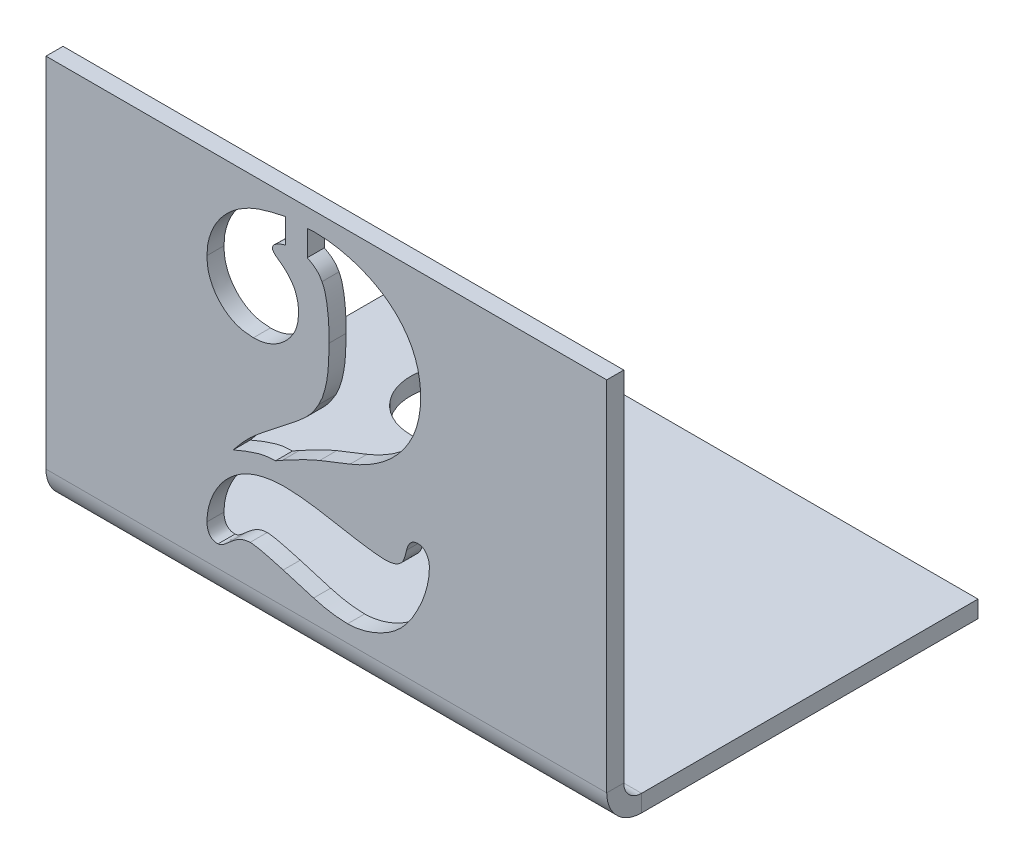
from build123d import *

# Parameters (mm, degrees)
SKETCH1_W            = 50
SKETCH1_H            = 30
BASE_FLANGE1_DEPTH   = 1.51892
EDGE_FLANGE1_DEPTH   = 50
M8_CLEARANCE_HOLE1_D = 9
CUT_EXTRUDE1_DEPTH   = 55.277389816


# Sheet-metal steps are written as plain solids
with BuildPart() as part:
    # Sketch1 → Base-Flange1 (new body)
    with BuildSketch(Plane(origin=(0, 0, 0), x_dir=(1, 0, 0), z_dir=(0, 1, 0))):
        with Locations((0, 15)):
            Rectangle(SKETCH1_W, SKETCH1_H)
    extrude(amount=BASE_FLANGE1_DEPTH)

    # Edge-Flange1 section (across the edge) → Edge-Flange1 (add)
    with BuildSketch(Plane(origin=(-25, 1.51892, 1.5875), x_dir=(0, 0, -1), z_dir=(1, 0, 0))):
        with BuildLine():
            Line((-1.51892, 1.5875), (-1.51892, 33.48108))
            Line((-1.51892, 33.48108), (0, 33.48108))
            Line((0, 33.48108), (0, 1.5875))
            ThreePointArc((0, 1.5875), (0.464967985, 0.464967985), (1.5875, 0))
            Line((1.5875, 0), (1.5875, -1.51892))
            ThreePointArc((1.5875, -1.51892), (-0.609070647, -0.609070647), (-1.51892, 1.5875))
        make_face()
    extrude(amount=EDGE_FLANGE1_DEPTH)

    # M8 Clearance Hole1 (through all)
    with Locations(Plane(origin=(0, 1.51892, 0), x_dir=(1, 0, 0), z_dir=(0, 1, 0))):
        with Locations((-13, 21.89358)):
            Hole(M8_CLEARANCE_HOLE1_D / 2)

    # Sketch11 → Cut-Extrude1 (cut, through all)
    with BuildSketch(Plane.XY.offset(3.10642)):
        with BuildLine():
            Line((-3.647316347, 33.285590278), (-3.647316347, 31.079861111))
            add(Edge.make_bspline(
                [(-3.647316347, 31.079861111), (-3.810339635, 31.035457881), (-4.114208976, 30.952691912), (-4.48274969, 30.752870531), (-4.763416976, 30.532872768), (-4.799006844, 30.340499168), (-4.813983013, 30.259548611)],
                knots=[0, 0, 0, 0, 1.333986203, 2.486500637, 3.363121469, 4, 4, 4, 4], degree=3))
            add(Edge.make_bspline(
                [(-4.813983013, 30.259548611), (-4.800725347, 30.209535104), (-4.770591799, 30.095858654), (-4.644434234, 29.942820848), (-4.470851038, 29.781940796), (-4.327601205, 29.686260997), (-4.248878847, 29.633680556)],
                knots=[0, 0, 0, 0, 0.71099317, 1.616027015, 2.68989741, 4, 4, 4, 4], degree=3))
            add(Edge.make_bspline(
                [(-4.248878847, 29.633680556), (-4.10113349, 29.524765386), (-3.818356416, 29.316307309), (-3.438695332, 28.974348022), (-3.136470959, 28.609228145), (-2.891592844, 28.230492233), (-2.705375929, 27.825549904), (-2.572503605, 27.386368), (-2.491790669, 26.906321015), (-2.484453005, 26.573534551), (-2.48064968, 26.401041667)],
                knots=[0, 0, 0, 0, 1.141533915, 2.18483766, 3.168868271, 4.081072748, 4.983039702, 5.931586172, 6.927881068, 8, 8, 8, 8], degree=3))
            add(Edge.make_bspline(
                [(-2.48064968, 26.401041667), (-2.493833545, 26.144173186), (-2.519898654, 25.63633234), (-2.754251301, 24.904916153), (-3.14419402, 24.235874886), (-3.661805059, 23.637265817), (-4.279520682, 23.134309517), (-4.972324544, 22.771644344), (-5.718765191, 22.538372238), (-6.238168745, 22.512965167), (-6.503219125, 22.5)],
                knots=[0, 0, 0, 0, 0.991379037, 1.960002132, 2.935410263, 3.96848841, 5.004590814, 5.996124549, 6.977427196, 8, 8, 8, 8], degree=3))
            add(Edge.make_bspline(
                [(-6.503219125, 22.5), (-6.788353705, 22.515022429), (-7.341745706, 22.544178107), (-8.136515362, 22.777043998), (-8.853492715, 23.168409838), (-9.482049424, 23.703394986), (-10.000937468, 24.352739178), (-10.373986742, 25.093874041), (-10.611343763, 25.908646232), (-10.635089286, 26.478349438), (-10.647316347, 26.771701389)],
                knots=[0, 0, 0, 0, 1.029099269, 1.997285998, 2.963451024, 3.960585897, 4.960778403, 5.946050082, 6.942378755, 8, 8, 8, 8], degree=3))
            add(Edge.make_bspline(
                [(-10.647316347, 26.771701389), (-10.637207367, 27.054569606), (-10.61710484, 27.617076), (-10.405860119, 28.439323827), (-10.101772493, 29.239337267), (-9.648933313, 29.990108087), (-9.100902708, 30.693428894), (-8.449289557, 31.322858562), (-7.709597457, 31.87812069), (-7.159775465, 32.170595566), (-6.879955236, 32.319444444)],
                knots=[0, 0, 0, 0, 0.958629846, 1.906313207, 2.866915443, 3.856727568, 4.870907364, 5.887603508, 6.924940656, 8, 8, 8, 8], degree=3))
            add(Edge.make_bspline(
                [(-6.879955236, 32.319444444), (-6.674785129, 32.41214962), (-6.23190241, 32.612264154), (-5.48161387, 32.855431525), (-4.608170132, 33.083047436), (-3.980138557, 33.215433135), (-3.647316347, 33.285590278)],
                knots=[0, 0, 0, 0, 0.798279449, 1.723175848, 2.793408359, 4, 4, 4, 4], degree=3))
        make_face()
        with BuildLine():
            Line((-1.702871902, 31.079861111), (-1.702871902, 33.346354167))
            Line((-1.702871902, 33.346354167), (-1.143844125, 33.388888889))
            add(Edge.make_bspline(
                [(-1.143844125, 33.388888889), (-0.788982189, 33.381216325), (-0.084790849, 33.365990818), (0.956855039, 33.228849557), (1.972192209, 33.000858662), (2.955414277, 32.69562596), (3.886975964, 32.308838774), (4.749040093, 31.854614583), (5.529514597, 31.325605134), (5.988092936, 30.913038341), (6.21466282, 30.709201389)],
                knots=[0, 0, 0, 0, 1.062126147, 2.107693046, 3.139094116, 4.174854052, 5.186216919, 6.154744676, 7.088314362, 8, 8, 8, 8], degree=3))
            add(Edge.make_bspline(
                [(6.21466282, 30.709201389), (6.391217286, 30.530779769), (6.739774477, 30.178536407), (7.181128593, 29.588291214), (7.564490126, 28.970373304), (7.873837187, 28.313773948), (8.110846122, 27.622292468), (8.282015002, 26.89795848), (8.386612379, 26.138749999), (8.400955874, 25.619544679), (8.408239209, 25.355902778)],
                knots=[0, 0, 0, 0, 1.011131168, 1.996194421, 2.964178307, 3.939713955, 4.916104062, 5.906671543, 6.937050386, 8, 8, 8, 8], degree=3))
            add(Edge.make_bspline(
                [(8.408239209, 25.355902778), (8.404193481, 25.126781786), (8.396184509, 24.673211059), (8.313601688, 24.00492042), (8.186107121, 23.35695107), (8.010523176, 22.727897526), (7.778642943, 22.117778767), (7.490672166, 21.528036783), (7.157247091, 20.95603062), (6.772545757, 20.407805906), (6.341665427, 19.885749696), (5.863848214, 19.392895499), (5.349947822, 18.923345023), (4.784212938, 18.490663539), (4.178974545, 18.085448248), (3.529159665, 17.707087874), (2.841292037, 17.353553824), (2.357623336, 17.151585865), (2.11310032, 17.049479167)],
                knots=[0, 0, 0, 0, 0.989048548, 1.957932644, 2.903152603, 3.83913997, 4.774882068, 5.717711062, 6.670349052, 7.631303691, 8.60679872, 9.590417157, 10.593637113, 11.61015386, 12.663052221, 13.737209596, 14.856026175, 16, 16, 16, 16], degree=3))
            Line((2.11310032, 17.049479167), (-0.590892736, 15.980034722))
            add(Edge.make_bspline(
                [(-0.590892736, 15.980034722), (-0.808461788, 15.888744669), (-1.289219684, 15.687022901), (-2.056332958, 15.311516557), (-2.946339923, 14.853212915), (-3.576968221, 14.514642154), (-3.914677458, 14.333333333)],
                knots=[0, 0, 0, 0, 0.762815795, 1.685578501, 2.760598724, 4, 4, 4, 4], degree=3))
            Line((-3.914677458, 14.333333333), (-4.534469125, 13.980902778))
            add(Edge.make_bspline(
                [(-4.534469125, 13.980902778), (-4.80262749, 13.970508896), (-5.335924706, 13.949838169), (-6.003944066, 13.804921778), (-6.565122006, 13.617885766), (-7.0763875, 13.448145558), (-7.662479348, 13.202604677), (-8.083027289, 13.028736376), (-8.307906625, 12.935763889)],
                knots=[0, 0, 0, 0, 1.222962542, 2.432154285, 3.101583781, 3.922999798, 4.889366993, 6, 6, 6, 6], degree=3))
            add(Edge.make_bspline(
                [(-8.307906625, 12.935763889), (-8.05969249, 13.245858512), (-7.58402807, 13.840107422), (-6.918656643, 14.526833924), (-6.33261269, 15.053107702), (-5.800924675, 15.49298605), (-5.184544696, 16.000268361), (-4.732216346, 16.3442061), (-4.491934402, 16.526909722)],
                knots=[0, 0, 0, 0, 1.359201953, 2.604702623, 3.26748845, 4.054955857, 4.966770519, 6, 6, 6, 6], degree=3))
            add(Edge.make_bspline(
                [(-4.491934402, 16.526909722), (-4.333947943, 16.648434791), (-4.031775986, 16.880869064), (-3.598228488, 17.214405846), (-3.208730936, 17.526140495), (-2.85829535, 17.809690562), (-2.546267621, 18.066804635), (-2.272622272, 18.295200165), (-2.043312176, 18.501753875), (-1.669646346, 18.847754129), (-1.180263403, 19.402829415), (-0.849575547, 19.962243014), (-0.682038569, 20.245659722)],
                knots=[0, 0, 0, 0, 1.113906191, 2.130506731, 3.056827448, 3.901845037, 4.649693062, 5.316382197, 5.893557715, 6.3740635, 8.162985332, 10, 10, 10, 10], degree=3))
            add(Edge.make_bspline(
                [(-0.682038569, 20.245659722), (-0.604416645, 20.400400772), (-0.445119906, 20.717962399), (-0.251966369, 21.230680972), (-0.09688995, 21.784575268), (0.03304193, 22.382849265), (0.130378679, 23.04249644), (0.192217456, 23.77509331), (0.237517513, 24.587690429), (0.24017711, 25.155308303), (0.241572542, 25.453125)],
                knots=[0, 0, 0, 0, 0.777423316, 1.5954384, 2.456703639, 3.359882465, 4.344440545, 5.450117435, 6.662132331, 8, 8, 8, 8], degree=3))
            add(Edge.make_bspline(
                [(0.241572542, 25.453125), (0.237903475, 25.716410971), (0.230874302, 26.22081245), (0.214797766, 26.94303959), (0.152786834, 27.596643496), (0.09429145, 28.186168321), (-0.001995148, 28.707827339), (-0.095584723, 29.166737384), (-0.232029987, 29.553457717), (-0.340056016, 29.782299823), (-0.390371902, 29.888888889)],
                knots=[0, 0, 0, 0, 1.399529948, 2.681209997, 3.837061676, 4.887895164, 5.82760427, 6.655409402, 7.373722527, 8, 8, 8, 8], degree=3))
            add(Edge.make_bspline(
                [(-0.390371902, 29.888888889), (-0.469496454, 30.026923654), (-0.615863943, 30.282265413), (-0.921574222, 30.592761773), (-1.278989282, 30.857205837), (-1.55252401, 31.000887005), (-1.702871902, 31.079861111)],
                knots=[0, 0, 0, 0, 1.053468207, 1.948744031, 2.872530685, 4, 4, 4, 4], degree=3))
        make_face()
        with BuildLine():
            add(Edge.make_bspline(
                [(8.140878098, 13.944444444), (8.211967353, 13.941048955), (8.352837629, 13.934320463), (8.561484708, 13.876622847), (8.737566119, 13.744840915), (8.899060741, 13.581959894), (9.022796357, 13.371602545), (9.124620576, 13.132015892), (9.175625475, 12.856826835), (9.182476201, 12.664505233), (9.186016987, 12.565104167)],
                knots=[0, 0, 0, 0, 0.879799571, 1.74340844, 2.625699862, 3.564480943, 4.565353137, 5.621124506, 6.770482576, 8, 8, 8, 8], degree=3))
            add(Edge.make_bspline(
                [(9.186016987, 12.565104167), (9.175584899, 12.325487575), (9.153942092, 11.828369867), (9.003937953, 11.065284795), (8.772027955, 10.259620149), (8.448693659, 9.43569982), (8.060267676, 8.633896912), (7.640660187, 7.887517923), (7.170922501, 7.229784204), (6.818093533, 6.845967871), (6.646086431, 6.658854167)],
                knots=[0, 0, 0, 0, 0.876433802, 1.818282945, 2.836180898, 3.941224477, 5.051547845, 6.093861336, 7.070741303, 8, 8, 8, 8], degree=3))
            add(Edge.make_bspline(
                [(6.646086431, 6.658854167), (6.491052264, 6.511612437), (6.175210582, 6.211645814), (5.639411386, 5.820791784), (5.048091158, 5.471604006), (4.417763253, 5.168985809), (3.76974575, 4.921097335), (3.129163542, 4.742855387), (2.505645065, 4.634904947), (2.09526217, 4.618931338), (1.89435032, 4.611111111)],
                knots=[0, 0, 0, 0, 0.968554714, 1.973177635, 2.998405239, 4.078582722, 5.139382544, 6.139673452, 7.089236778, 8, 8, 8, 8], degree=3))
            add(Edge.make_bspline(
                [(1.89435032, 4.611111111), (1.65099084, 4.61698407), (1.156557716, 4.628916152), (0.407970466, 4.727496388), (-0.362565152, 4.869823269), (-0.87539186, 5.012216999), (-1.137767736, 5.085069444)],
                knots=[0, 0, 0, 0, 0.948215362, 1.926487859, 2.939135665, 4, 4, 4, 4], degree=3))
            Line((-1.137767736, 5.085069444), (-3.84783718, 5.893229167))
            add(Edge.make_bspline(
                [(-3.84783718, 5.893229167), (-4.027876834, 5.946670405), (-4.372771476, 6.049045612), (-4.867209764, 6.182546525), (-5.312805375, 6.287963177), (-5.703393109, 6.390958158), (-6.046219296, 6.463215647), (-6.340427988, 6.511699404), (-6.583530961, 6.545061983), (-6.729998774, 6.552333975), (-6.794885791, 6.555555556)],
                knots=[0, 0, 0, 0, 1.489294531, 2.852980966, 4.060646367, 5.120269851, 6.055888912, 6.837513082, 7.485004198, 8, 8, 8, 8], degree=3))
            add(Edge.make_bspline(
                [(-6.794885791, 6.555555556), (-6.948302462, 6.542475572), (-7.26855105, 6.515171848), (-7.748618591, 6.32175072), (-8.235527513, 6.012220058), (-8.54061631, 5.740170449), (-8.702871902, 5.595486111)],
                knots=[0, 0, 0, 0, 0.84199064, 1.757607651, 2.807426876, 4, 4, 4, 4], degree=3))
            add(Edge.make_bspline(
                [(-8.702871902, 5.595486111), (-8.800249725, 5.50587762), (-8.974723699, 5.345324127), (-9.235746676, 5.160427329), (-9.455192829, 5.029687605), (-9.601102569, 5.008836863), (-9.662941347, 5)],
                knots=[0, 0, 0, 0, 1.379773841, 2.472170975, 3.352482715, 4, 4, 4, 4], degree=3))
            add(Edge.make_bspline(
                [(-9.662941347, 5), (-9.738440499, 5.002377186), (-9.882126501, 5.006901321), (-10.082586556, 5.072034039), (-10.256384907, 5.168945819), (-10.402314044, 5.307914172), (-10.509210789, 5.487698429), (-10.589351397, 5.69938319), (-10.636678296, 5.943862741), (-10.643653718, 6.117846576), (-10.647316347, 6.209201389)],
                knots=[0, 0, 0, 0, 1.019998235, 1.941206801, 2.827324643, 3.701864353, 4.639723837, 5.639914396, 6.760774658, 8, 8, 8, 8], degree=3))
            add(Edge.make_bspline(
                [(-10.647316347, 6.209201389), (-10.641859823, 6.398002104), (-10.630816848, 6.780099163), (-10.526971097, 7.351839666), (-10.369576917, 7.928690335), (-10.142761079, 8.500531894), (-9.868338771, 9.061995486), (-9.537023031, 9.590398995), (-9.167945124, 10.089272953), (-8.882441306, 10.386568506), (-8.739330236, 10.535590278)],
                knots=[0, 0, 0, 0, 0.934345316, 1.890938798, 2.869377503, 3.892173595, 4.933063319, 5.96032697, 6.977597594, 8, 8, 8, 8], degree=3))
            add(Edge.make_bspline(
                [(-8.739330236, 10.535590278), (-8.58044067, 10.683182049), (-8.262856085, 10.978184876), (-7.728207443, 11.353847368), (-7.155735783, 11.678839537), (-6.537742861, 11.940856733), (-5.876935358, 12.139589762), (-5.175865998, 12.286406199), (-4.431203082, 12.370771536), (-3.920964933, 12.382749971), (-3.659469125, 12.388888889)],
                knots=[0, 0, 0, 0, 0.936437632, 1.871728672, 2.816478044, 3.777515665, 4.76618951, 5.794684412, 6.86978113, 8, 8, 8, 8], degree=3))
            add(Edge.make_bspline(
                [(-3.659469125, 12.388888889), (-3.387893669, 12.381702978), (-2.801122986, 12.366176972), (-1.856298251, 12.274488514), (-0.782003059, 12.128722948), (-0.025305396, 11.992903222), (0.375253098, 11.921006944)],
                knots=[0, 0, 0, 0, 0.801463553, 1.731656178, 2.799250441, 4, 4, 4, 4], degree=3))
            add(Edge.make_bspline(
                [(0.375253098, 11.921006944), (0.670800522, 11.865362658), (1.235019988, 11.759134055), (2.042089156, 11.622596854), (2.766257401, 11.497071313), (3.411068437, 11.402107947), (3.975587257, 11.320248236), (4.459840232, 11.265020428), (4.863265874, 11.232837696), (5.104670495, 11.22549057), (5.212058653, 11.222222222)],
                knots=[0, 0, 0, 0, 1.47561612, 2.8170482, 4.016309835, 5.081718312, 6.01497989, 6.815070825, 7.472887633, 8, 8, 8, 8], degree=3))
            add(Edge.make_bspline(
                [(5.212058653, 11.222222222), (5.366665709, 11.226936043), (5.656684991, 11.235778452), (6.05663228, 11.329061675), (6.40108337, 11.470138823), (6.57836829, 11.622376225), (6.664315598, 11.696180556)],
                knots=[0, 0, 0, 0, 1.182806183, 2.218764207, 3.13646112, 4, 4, 4, 4], degree=3))
            add(Edge.make_bspline(
                [(6.664315598, 11.696180556), (6.715435808, 11.759318876), (6.816854904, 11.8845811), (6.939283544, 12.131953432), (7.050329567, 12.481833154), (7.116494605, 12.760926256), (7.156503098, 12.9296875)],
                knots=[0, 0, 0, 0, 0.724158961, 1.436683173, 2.450020675, 4, 4, 4, 4], degree=3))
            add(Edge.make_bspline(
                [(7.156503098, 12.9296875), (7.19769713, 13.074411112), (7.273784587, 13.341722931), (7.488099894, 13.676181312), (7.789637151, 13.894225357), (8.022154272, 13.927469766), (8.140878098, 13.944444444)],
                knots=[0, 0, 0, 0, 1.178432601, 2.176624505, 3.068979898, 4, 4, 4, 4], degree=3))
        make_face()
    extrude(amount=-CUT_EXTRUDE1_DEPTH, mode=Mode.SUBTRACT)


solid = part.part
